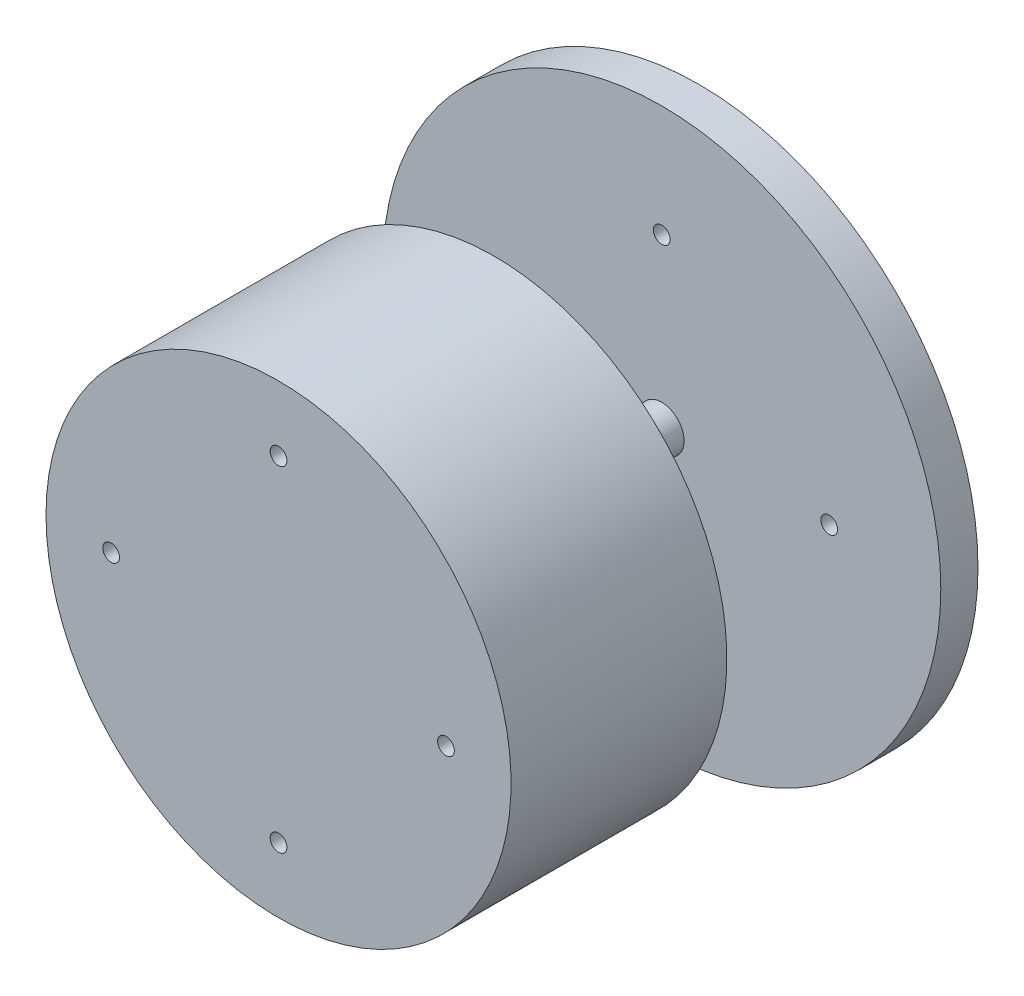
from build123d import *

# Parameters (mm, degrees)
SKETCH1_R           = 62.5
BOSS_EXTRUDE1_DEPTH = 58
SKETCH2_R           = 6
BOSS_EXTRUDE2_DEPTH = 113
SKETCH3_R           = 75
BOSS_EXTRUDE3_DEPTH = 10
SKETCH4_R           = 2.25
CUT_EXTRUDE1_DEPTH  = 133
SKETCH5_R           = 2.25
CUT_EXTRUDE2_DEPTH  = 133
SKETCH6_R           = 2.25
CUT_EXTRUDE3_DEPTH  = 133
SKETCH7_R           = 2.25
CUT_EXTRUDE4_DEPTH  = 133


with BuildPart() as part:
    # Sketch1 → Boss-Extrude1 (new body)
    with BuildSketch(Plane.XY.offset(55)):
        with Locations((300, 300)):
            Circle(SKETCH1_R)
    extrude(amount=BOSS_EXTRUDE1_DEPTH)

    # Sketch2 → Boss-Extrude2 (add)
    with BuildSketch(Plane.XY):
        with Locations((300, 300)):
            Circle(SKETCH2_R)
    extrude(amount=BOSS_EXTRUDE2_DEPTH)

    # Sketch3 → Boss-Extrude3 (add)
    with BuildSketch(Plane.XY):
        with Locations((300, 300)):
            Circle(SKETCH3_R)
    extrude(amount=BOSS_EXTRUDE3_DEPTH)

    # Sketch4 → Cut-Extrude1 (cut)
    with BuildSketch(Plane.XY.offset(113)):
        with Locations((345, 300)):
            Circle(SKETCH4_R)
    extrude(amount=-CUT_EXTRUDE1_DEPTH, mode=Mode.SUBTRACT)

    # Sketch5 → Cut-Extrude2 (cut)
    with BuildSketch(Plane.XY.offset(113)):
        with Locations((255, 300)):
            Circle(SKETCH5_R)
    extrude(amount=-CUT_EXTRUDE2_DEPTH, mode=Mode.SUBTRACT)

    # Sketch6 → Cut-Extrude3 (cut)
    with BuildSketch(Plane.XY.offset(113)):
        with Locations((300, 345)):
            Circle(SKETCH6_R)
    extrude(amount=-CUT_EXTRUDE3_DEPTH, mode=Mode.SUBTRACT)

    # Sketch7 → Cut-Extrude4 (cut)
    with BuildSketch(Plane.XY.offset(113)):
        with Locations((300, 255)):
            Circle(SKETCH7_R)
    extrude(amount=-CUT_EXTRUDE4_DEPTH, mode=Mode.SUBTRACT)


solid = part.part
